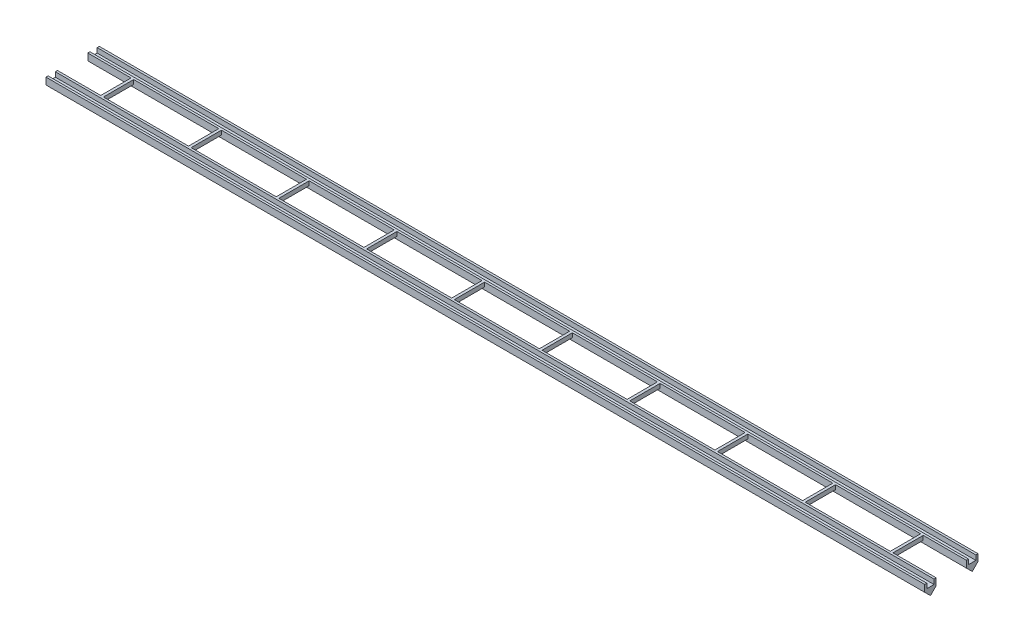
from build123d import *

# Parameters (mm, degrees)
BOSS_EXTRUDE1_DEPTH   = 304.8
BOSS_EXTRUDE1_2_DEPTH = 304.8
BOSS_EXTRUDE2_REACH   = 307.176


with BuildPart() as part:
    # Sketch1 → Boss-Extrude1 (new body)
    with BuildSketch(Plane(origin=(0, 0, 0), x_dir=(0, 0, -1), z_dir=(1, 0, 0))):
        Polygon((5.25389401, 0), (5.25389401, -2.366967552), (7.25, -4.363073542), (9.24610599, -2.366967552), (9.24610599, 0), (8.5, 0), (8.5, -1.649283967), (6, -1.649283967), (6, 0), align=None)
    extrude(amount=BOSS_EXTRUDE1_DEPTH)


with BuildPart() as body_2:
    # Sketch1 → Boss-Extrude1 2 (new body)
    with BuildSketch(Plane(origin=(0, 0, 0), x_dir=(0, 0, -1), z_dir=(1, 0, 0))):
        Polygon((-6, 0), (-5.25389401, 0), (-5.25389401, -2.366967552), (-7.25, -4.363073542), (-9.24610599, -2.366967552), (-9.24610599, 0), (-8.5, 0), (-8.5, -1.649283967), (-6, -1.649283967), align=None)
    extrude(amount=BOSS_EXTRUDE1_2_DEPTH)

    # Sketch2 → Boss-Extrude2 (add, up to next)
    with BuildSketch(Plane.XY.offset(-5.25389401), mode=Mode.PRIVATE) as boss_extrude2_sk1:
        Polygon((15, 0), (15.922131776, 0), (15.922131776, -1.477970093), (15.461065888, -1.939035981), (15, -1.477970093), align=None)
    boss_extrude2_tool1 = extrude(boss_extrude2_sk1.sketch, amount=BOSS_EXTRUDE2_REACH, mode=Mode.PRIVATE) - body_2.part
    # Sketch2 → Boss-Extrude2 (add, up to next)
    with BuildSketch(Plane.XY.offset(-5.25389401), mode=Mode.PRIVATE) as boss_extrude2_sk2:
        Polygon((45.430874247, 0), (46.353006023, 0), (46.353006023, -1.477970093), (45.891940135, -1.939035981), (45.430874247, -1.477970093), align=None)
    boss_extrude2_tool2 = extrude(boss_extrude2_sk2.sketch, amount=BOSS_EXTRUDE2_REACH, mode=Mode.PRIVATE) - body_2.part
    # Sketch2 → Boss-Extrude2 (add, up to next)
    with BuildSketch(Plane.XY.offset(-5.25389401), mode=Mode.PRIVATE) as boss_extrude2_sk3:
        Polygon((75.861748494, 0), (76.78388027, 0), (76.78388027, -1.477970093), (76.322814382, -1.939035981), (75.861748494, -1.477970093), align=None)
    boss_extrude2_tool3 = extrude(boss_extrude2_sk3.sketch, amount=BOSS_EXTRUDE2_REACH, mode=Mode.PRIVATE) - body_2.part
    # Sketch2 → Boss-Extrude2 (add, up to next)
    with BuildSketch(Plane.XY.offset(-5.25389401), mode=Mode.PRIVATE) as boss_extrude2_sk4:
        Polygon((106.292622741, 0), (107.214754518, 0), (107.214754518, -1.477970093), (106.753688629, -1.939035981), (106.292622741, -1.477970093), align=None)
    boss_extrude2_tool4 = extrude(boss_extrude2_sk4.sketch, amount=BOSS_EXTRUDE2_REACH, mode=Mode.PRIVATE) - body_2.part
    # Sketch2 → Boss-Extrude2 (add, up to next)
    with BuildSketch(Plane.XY.offset(-5.25389401), mode=Mode.PRIVATE) as boss_extrude2_sk5:
        Polygon((136.723496988, 0), (137.645628765, 0), (137.645628765, -1.477970093), (137.184562876, -1.939035981), (136.723496988, -1.477970093), align=None)
    boss_extrude2_tool5 = extrude(boss_extrude2_sk5.sketch, amount=BOSS_EXTRUDE2_REACH, mode=Mode.PRIVATE) - body_2.part
    # Sketch2 → Boss-Extrude2 (add, up to next)
    with BuildSketch(Plane.XY.offset(-5.25389401), mode=Mode.PRIVATE) as boss_extrude2_sk6:
        Polygon((167.154371235, 0), (168.076503012, 0), (168.076503012, -1.477970093), (167.615437124, -1.939035981), (167.154371235, -1.477970093), align=None)
    boss_extrude2_tool6 = extrude(boss_extrude2_sk6.sketch, amount=BOSS_EXTRUDE2_REACH, mode=Mode.PRIVATE) - body_2.part
    # Sketch2 → Boss-Extrude2 (add, up to next)
    with BuildSketch(Plane.XY.offset(-5.25389401), mode=Mode.PRIVATE) as boss_extrude2_sk7:
        Polygon((197.585245482, 0), (198.507377259, 0), (198.507377259, -1.477970093), (198.046311371, -1.939035981), (197.585245482, -1.477970093), align=None)
    boss_extrude2_tool7 = extrude(boss_extrude2_sk7.sketch, amount=BOSS_EXTRUDE2_REACH, mode=Mode.PRIVATE) - body_2.part
    # Sketch2 → Boss-Extrude2 (add, up to next)
    with BuildSketch(Plane.XY.offset(-5.25389401), mode=Mode.PRIVATE) as boss_extrude2_sk8:
        Polygon((228.01611973, 0), (228.938251506, 0), (228.938251506, -1.477970093), (228.477185618, -1.939035981), (228.01611973, -1.477970093), align=None)
    boss_extrude2_tool8 = extrude(boss_extrude2_sk8.sketch, amount=BOSS_EXTRUDE2_REACH, mode=Mode.PRIVATE) - body_2.part
    # Sketch2 → Boss-Extrude2 (add, up to next)
    with BuildSketch(Plane.XY.offset(-5.25389401), mode=Mode.PRIVATE) as boss_extrude2_sk9:
        Polygon((258.446993977, 0), (259.369125753, 0), (259.369125753, -1.477970093), (258.908059865, -1.939035981), (258.446993977, -1.477970093), align=None)
    boss_extrude2_tool9 = extrude(boss_extrude2_sk9.sketch, amount=BOSS_EXTRUDE2_REACH, mode=Mode.PRIVATE) - body_2.part
    # Sketch2 → Boss-Extrude2 (add, up to next)
    with BuildSketch(Plane.XY.offset(-5.25389401), mode=Mode.PRIVATE) as boss_extrude2_sk10:
        Polygon((288.877868224, 0), (289.8, 0), (289.8, -1.477970093), (289.338934112, -1.939035981), (288.877868224, -1.477970093), align=None)
    boss_extrude2_tool10 = extrude(boss_extrude2_sk10.sketch, amount=BOSS_EXTRUDE2_REACH, mode=Mode.PRIVATE) - body_2.part

    add(part.part)  # Boss-Extrude2 merges part
    add(boss_extrude2_tool1.solids().sort_by_distance((15.461066, -0.859436, -5.253894))[0])
    add(boss_extrude2_tool2.solids().sort_by_distance((45.89194, -0.859436, -5.253894))[0])
    add(boss_extrude2_tool3.solids().sort_by_distance((76.322814, -0.859436, -5.253894))[0])
    add(boss_extrude2_tool4.solids().sort_by_distance((106.753689, -0.859436, -5.253894))[0])
    add(boss_extrude2_tool5.solids().sort_by_distance((137.184563, -0.859436, -5.253894))[0])
    add(boss_extrude2_tool6.solids().sort_by_distance((167.615437, -0.859436, -5.253894))[0])
    add(boss_extrude2_tool7.solids().sort_by_distance((198.046311, -0.859436, -5.253894))[0])
    add(boss_extrude2_tool8.solids().sort_by_distance((228.477186, -0.859436, -5.253894))[0])
    add(boss_extrude2_tool9.solids().sort_by_distance((258.90806, -0.859436, -5.253894))[0])
    add(boss_extrude2_tool10.solids().sort_by_distance((289.338934, -0.859436, -5.253894))[0])


solid = body_2.part
